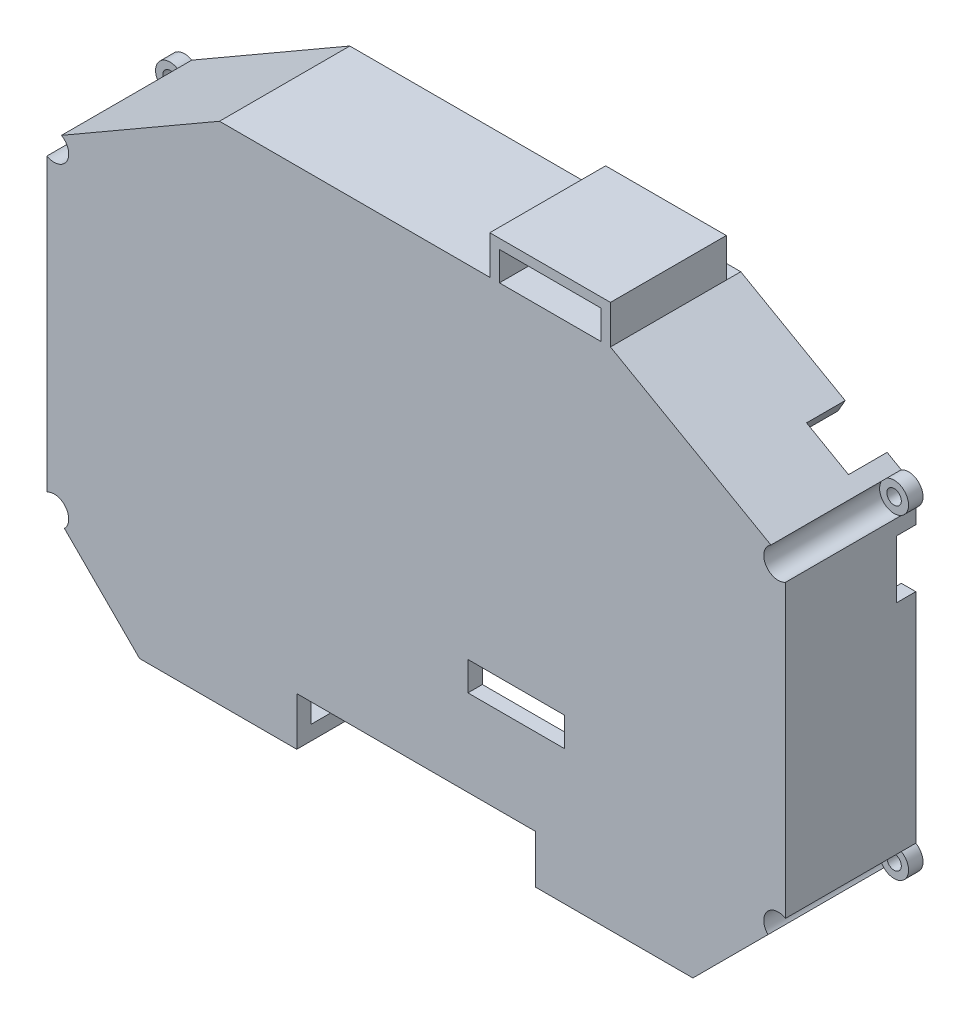
from build123d import *

# Parameters (mm, degrees)
SKETCH_2_R          = 1.5
EXTRUDE_1_DEPTH     = 27
SHELL_1_DEPTH       = 24
CUT_EXTRUDE_START   = -24
SKETCH_3_R          = 3
CUT_EXTRUDE_1_DEPTH = 24
SKETCH_5_W          = 20
SKETCH_5_H          = 6
CUT_EXTRUDE_3_DEPTH = 32
SKETCH_6_W          = 4
SKETCH_6_H          = 12
CUT_EXTRUDE_4_DEPTH = 32
SKETCH_7_W          = 10
SKETCH_7_H          = 8
CUT_EXTRUDE_5_DEPTH = 32
EXTRUDE_2_DEPTH     = 24
SKETCH_9_W          = 10
SKETCH_9_H          = 3
CUT_EXTRUDE_6_DEPTH = 24
SKETCH_10_R         = 1.35
CUT_EXTRUDE_7_DEPTH = 10
CUT_EXTRUDE_8_DEPTH = 10
CUT_EXTRUDE_9_DEPTH = 10


# Read off the part's stored shape, not the designer's step: 抽壳1
with BuildPart() as part:
    # 草图2 → 凸台-拉伸1 (new body)
    with BuildSketch(Plane.XY):
        with BuildLine():
            Line((-76.5, 30.151923789), (-76.5, -30.151923789))
            ThreePointArc((-76.5, -30.151923789), (-77.380060021, -34.576284287), (-72.878679656, -34.871320344))
            Line((-72.878679656, -34.871320344), (-57.32, -50.43))
            Line((-57.32, -50.43), (57.32, -50.43))
            Line((57.32, -50.43), (72.878679656, -34.871320344))
            ThreePointArc((72.878679656, -34.871320344), (77.380060021, -34.576284287), (76.5, -30.151923789))
            Line((76.5, -30.151923789), (76.5, 30.151923789))
            ThreePointArc((76.5, 30.151923789), (77.593259199, 34.258312544), (73.483390382, 35.33841559))
            Line((73.483390382, 35.33841559), (40.238526366, 54.25))
            Line((40.238526366, 54.25), (-40.760907637, 54.25))
            Line((-40.760907637, 54.25), (-73.5, 35.348076211))
            ThreePointArc((-73.5, 35.348076211), (-77.598076211, 34.25), (-76.5, 30.151923789))
        make_face()
        with Locations((-75, 32.75)):
            Circle(SKETCH_2_R, mode=Mode.SUBTRACT)
        with Locations((75, 32.75)):
            Circle(SKETCH_2_R, mode=Mode.SUBTRACT)
        with Locations((75, -32.75)):
            Circle(SKETCH_2_R, mode=Mode.SUBTRACT)
        with Locations((-75, -32.75)):
            Circle(SKETCH_2_R, mode=Mode.SUBTRACT)
    extrude(amount=EXTRUDE_1_DEPTH)

    # 抽壳1 outline → 抽壳1 (cut)
    with BuildSketch(Plane.XY):
        with BuildLine():
            Line((-73.5, 28.507359313), (-73.5, -28.507359313))
            ThreePointArc((-73.5, -28.507359313), (-71.254879923, -30.255190266), (-70.506971411, -33.000387902))
            Line((-70.506971411, -33.000387902), (-56.077359313, -47.43))
            Line((-56.077359313, -47.43), (56.077359313, -47.43))
            Line((56.077359313, -47.43), (70.506971411, -33.000387902))
            ThreePointArc((70.506971411, -33.000387902), (71.254879923, -30.255190266), (73.5, -28.507359313))
            Line((73.5, -28.507359313), (73.5, 28.507359313))
            ThreePointArc((73.5, 28.507359313), (71.110106029, 30.48754008), (70.570593139, 33.543948905))
            Line((70.570593139, 33.543948905), (39.444948236, 51.25))
            Line((39.444948236, 51.25), (-39.95706006, 51.25))
            Line((-39.95706006, 51.25), (-70.575765386, 33.572282238))
            ThreePointArc((-70.575765386, 33.572282238), (-71.102885683, 30.5), (-73.5, 28.507359313))
        make_face()
    extrude(amount=SHELL_1_DEPTH, mode=Mode.SUBTRACT)

    # 草图3 → 切除-拉伸1 (cut)
    with BuildSketch(Plane.XY.offset(27).offset(CUT_EXTRUDE_START)):
        with Locations((75, 32.75)):
            Circle(SKETCH_3_R)
        with Locations((75, -32.75)):
            Circle(SKETCH_3_R)
        with Locations((-75, -32.75)):
            Circle(SKETCH_3_R)
        with Locations((-75, 32.75)):
            Circle(SKETCH_3_R)
    extrude(amount=CUT_EXTRUDE_1_DEPTH, mode=Mode.SUBTRACT)

    # 草图5 → 切除-拉伸3 (cut)
    with BuildSketch(Plane.XY.offset(27)):
        with Locations((20.7074416, -19.577067137)):
            Rectangle(SKETCH_5_W, SKETCH_5_H)
    extrude(amount=-CUT_EXTRUDE_3_DEPTH, mode=Mode.SUBTRACT)

    # 草图6 → 切除-拉伸4 (cut)
    with BuildSketch(Plane(origin=(76.5, 0, 0), x_dir=(0, 0, -1), z_dir=(1, 0, 0))):
        with Locations((-2, 20.977362477)):
            Rectangle(SKETCH_6_W, SKETCH_6_H)
    extrude(amount=-CUT_EXTRUDE_4_DEPTH, mode=Mode.SUBTRACT)

    # 草图7 → 切除-拉伸5 (cut)
    with BuildSketch(Plane(origin=(33.153284591, 58.280491682, 0), x_dir=(0.8692042501767389, -0.4944532045347601, 0), z_dir=(0.4944532045347601, 0.8692042501767389, 0))):
        with Locations((38.03253292, -4)):
            Rectangle(SKETCH_7_W, SKETCH_7_H)
    extrude(amount=-CUT_EXTRUDE_5_DEPTH, mode=Mode.SUBTRACT)

    # 草图8 → 凸台-拉伸2 (add)
    with BuildSketch(Plane.XY.offset(27)):
        Polygon((40.238526366, 54.25), (40.238526366, 62.25), (15.238526366, 62.25), (15.238526366, 54.25), (17.238526366, 54.25), (17.238526366, 60.25), (38.238526366, 60.25), (38.238526366, 54.25), align=None)
    extrude(amount=-EXTRUDE_2_DEPTH)

    # 草图9 → 切除-拉伸6 (cut)
    with BuildSketch(Plane(origin=(0, 54.25, 0), x_dir=(1, 0, 0), z_dir=(0, 1, 0))):
        with Locations((27.738526366, -1.5)):
            Rectangle(SKETCH_9_W, SKETCH_9_H)
    extrude(amount=-CUT_EXTRUDE_6_DEPTH, mode=Mode.SUBTRACT)

    # 草图10 → 切除-拉伸7 (cut)
    with BuildSketch(Plane.XZ.offset(50.43)):
        with Locations((-18.75, 20)):
            Circle(SKETCH_10_R)
        with Locations((18.75, 20)):
            Circle(SKETCH_10_R)
    extrude(amount=-CUT_EXTRUDE_7_DEPTH, mode=Mode.SUBTRACT)

    # 草图11 → 切除-拉伸8 (cut)
    with BuildSketch(Plane.XZ.offset(50.43)):
        Polygon((0, 3), (2, 3), (2, 0), (-2, 0), (-2, 3), align=None)
    extrude(amount=-CUT_EXTRUDE_8_DEPTH, mode=Mode.SUBTRACT)

    # 草图12 → 切除-拉伸9 (cut)
    with BuildSketch(Plane.XZ.offset(50.43)):
        Polygon((-24.75, 20), (-24.75, 27), (24.75, 27), (24.75, 20), (24.75, 0), (-24.75, 0), align=None)
    extrude(amount=-CUT_EXTRUDE_9_DEPTH, mode=Mode.SUBTRACT)


solid = part.part
